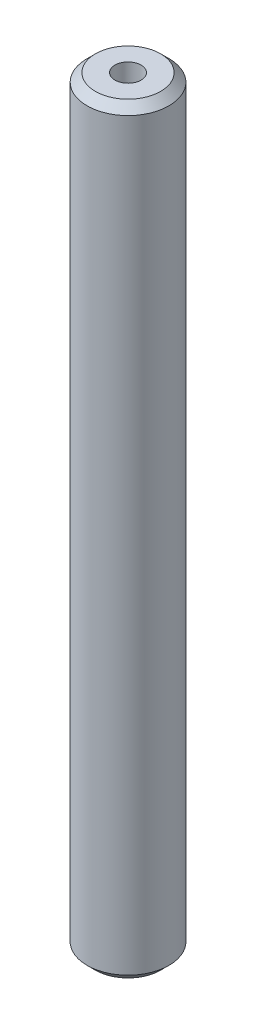
from build123d import *

# Parameters (mm, degrees)
SKETCH1_R           = 25
BOSS_EXTRUDE1_DEPTH = 464.819685033
SKETCH2_R           = 7.98255586
CUT_EXTRUDE1_DEPTH  = 467.162353257
CHAMFER1_SIZE       = 5.080267039


with BuildPart() as part:
    # Sketch1 → Boss-Extrude1 (new body)
    with BuildSketch(Plane(origin=(0, 0, 0), x_dir=(1, 0, 0), z_dir=(0, 1, 0))):
        Circle(SKETCH1_R)
    extrude(amount=BOSS_EXTRUDE1_DEPTH)

    # Sketch2 → Cut-Extrude1 (cut, through all)
    with BuildSketch(Plane(origin=(0, 0, 0), x_dir=(1, 0, 0), z_dir=(0, 1, 0))):
        Circle(SKETCH2_R)
    extrude(amount=CUT_EXTRUDE1_DEPTH, mode=Mode.SUBTRACT)

    # Chamfer1
    chamfer1_edges = [part.edges().sort_by_distance(p)[0] for p in [
        (-25, 464.819685033, 0),
        (-25, 0, 0),
    ]]
    chamfer(chamfer1_edges, length=CHAMFER1_SIZE)


solid = part.part
